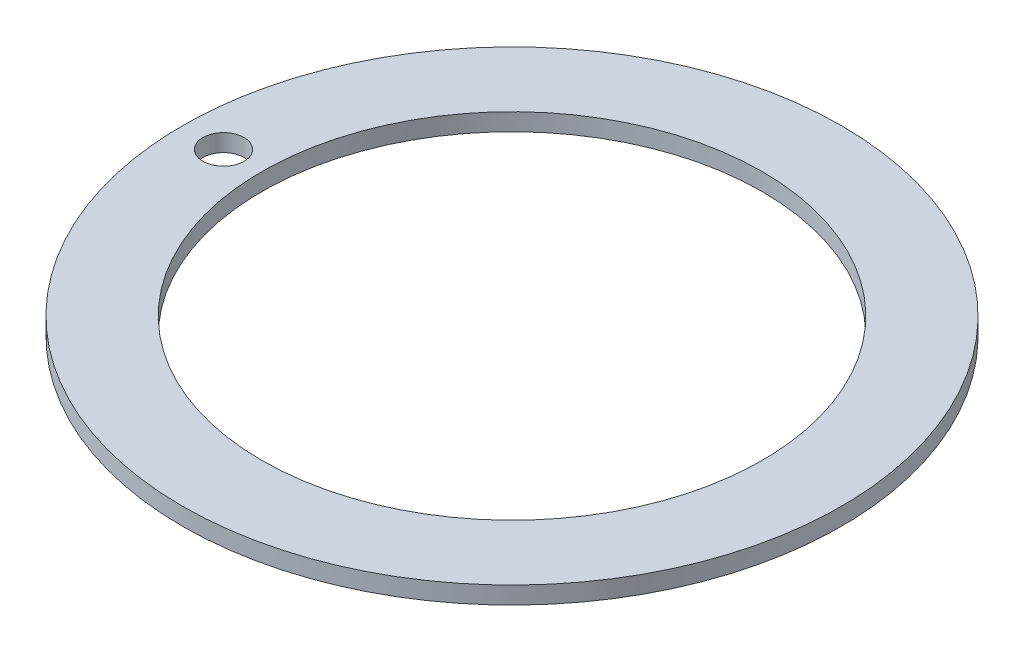
from build123d import *

# Parameters (mm, degrees)
SKETCH1_R           = 38.0746
SKETCH1_R_2         = 28.9052
BOSS_EXTRUDE1_DEPTH = 2.0066
SKETCH2_R           = 2.38125
CUT_EXTRUDE2_DEPTH  = 2.54


with BuildPart() as part:
    # Sketch1 → Boss-Extrude1 (new body)
    with BuildSketch(Plane(origin=(0, 0, 0), x_dir=(1, 0, 0), z_dir=(0, 1, 0))):
        Circle(SKETCH1_R)
        Circle(SKETCH1_R_2, mode=Mode.SUBTRACT)
    extrude(amount=BOSS_EXTRUDE1_DEPTH)

    # Sketch2 → Cut-Extrude2 (cut)
    with BuildSketch(Plane(origin=(0, 2.0066, 0), x_dir=(1, 0, 0), z_dir=(0, 1, 0))):
        with Locations((-33.329941143, 0)):
            Circle(SKETCH2_R)
    extrude(amount=-CUT_EXTRUDE2_DEPTH, mode=Mode.SUBTRACT)


solid = part.part
